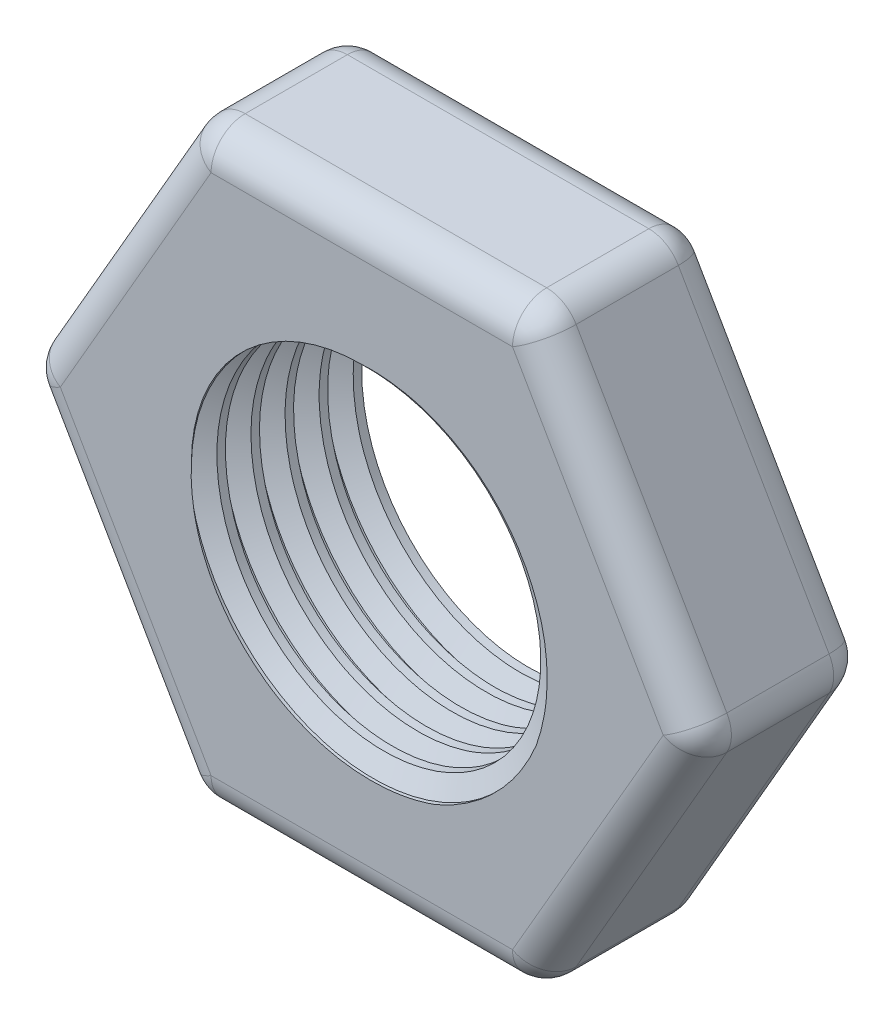
from build123d import *

# Parameters (mm, degrees)
ESQUISSE1_R        = 5
BOSS_EXTRU_1_DEPTH = 5
FILETAGE1_PITCH    = 1
CONG_1_R           = 1


with BuildPart() as part:
    # Esquisse1 → Boss.-Extru.1 (new body)
    with BuildSketch(Plane.XY):
        Polygon((10, 0), (5, 8.660254038), (-5, 8.660254038), (-10, 0), (-5, -8.660254038), (5, -8.660254038), align=None)
        Circle(ESQUISSE1_R, mode=Mode.SUBTRACT)
    extrude(amount=BOSS_EXTRU_1_DEPTH)

    # Filetage1: the profile of Profil de filetage1 profile screwed along a right-hand helix of 6 turns, 8 arcs to a turn; built about Z, then put on its axis
    filetage1_z = Axis((0, 0, 0), (0, 0, 1))
    filetage1_corners = [(4.9997, 0, -0.000173205), (5.541265875, 0, 0.312499999), (5.541265875, 0, 0.437499999), (4.9997, 0, 0.750173202)]
    with BuildLine(mode=Mode.PRIVATE) as filetage1_profile:
        Line(filetage1_corners[0], filetage1_corners[1])
        Line(filetage1_corners[1], filetage1_corners[2])
        Line(filetage1_corners[2], filetage1_corners[3])
        Line(filetage1_corners[3], filetage1_corners[0])
    filetage1_cap = Face(filetage1_profile.wire())
    filetage1_turn_angles = [0, 22.5, 45, 67.5, 90, 112.5, 135, 157.5, 180, 202.5, 225, 247.5, 270, 292.5, 315, 337.5, 360]
    filetage1_turn_weights = [1, 0.9238795325112867, 1, 0.9238795325112867, 1, 0.9238795325112867, 1, 0.9238795325112867, 1, 0.9238795325112867, 1, 0.9238795325112867, 1, 0.9238795325112867, 1, 0.9238795325112867, 1]
    filetage1_turn_rails = [Edge.make_bspline([Vector(p[0], p[1], 0).rotate(filetage1_z, filetage1_turn_angles[k]) / filetage1_turn_weights[k] + Vector(0, 0, p[2] + FILETAGE1_PITCH * filetage1_turn_angles[k] / 360) for k in range(17)], [0, 0, 0, 1, 1, 2, 2, 3, 3, 4, 4, 5, 5, 6, 6, 7, 7, 8, 8, 8], 2, filetage1_turn_weights) for p in filetage1_corners]
    filetage1_turn_sides = [Face.make_surface_from_curves(filetage1_turn_rails[p[0]], filetage1_turn_rails[p[1]]) for p in [(0, 1), (1, 2), (2, 3), (3, 0)]]
    filetage1 = Plane(origin=(0, 0, 6), x_dir=(-1, 0, 0), z_dir=(0, 0, -1)) * Solid(Shell([*[p.moved(Location((0, 0, FILETAGE1_PITCH * i))) for i in range(6) for p in filetage1_turn_sides], filetage1_cap, filetage1_cap.rotate(filetage1_z, 2160).moved(Location((0, 0, FILETAGE1_PITCH * 2160 / 360)))]))
    add(filetage1, mode=Mode.SUBTRACT)

    # Congé1
    cong_1_edges = [part.edges().sort_by_distance(p)[0] for p in [
        (5, -8.660254038, 2.5),
        (-5, -8.660254038, 2.5),
        (-10, 0, 2.5),
        (-5, 8.660254038, 2.5),
        (5, 8.660254038, 2.5),
        (10, 0, 2.5),
        (0, 8.660254038, 5),
        (-7.5, 4.330127019, 5),
        (-7.5, -4.330127019, 5),
        (0, -8.660254038, 5),
        (7.5, -4.330127019, 5),
        (0, -8.660254038, 0),
        (-7.5, -4.330127019, 0),
        (-7.5, 4.330127019, 0),
        (0, 8.660254038, 0),
        (7.5, 4.330127019, 0),
        (7.5, -4.330127019, 0),
        (7.5, 4.330127019, 5),
    ]]
    fillet(cong_1_edges, radius=CONG_1_R)


solid = part.part
